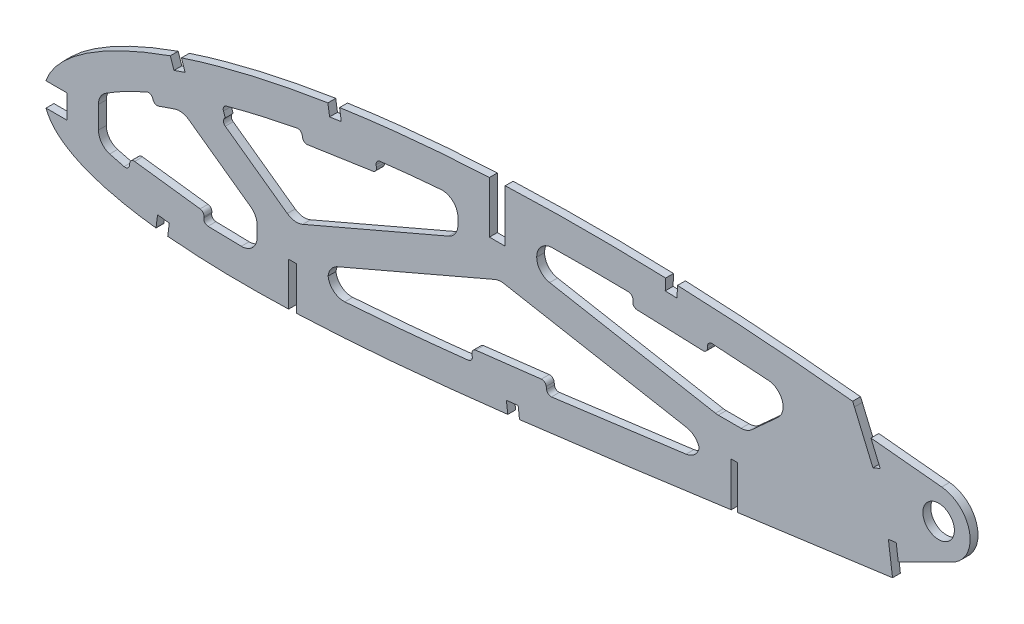
from build123d import *

# Parameters (mm, degrees)
BOSS_EXTRUDE1_DEPTH = 3.175
CUT_EXTRUDE1_DEPTH  = 7.62
SKETCH4_R           = 6.35
CUT_EXTRUDE2_DEPTH  = 7.62
CUT_EXTRUDE3_DEPTH  = 7.62
SKETCH6_W           = 9.525
SKETCH6_H           = 9.525
CUT_EXTRUDE4_DEPTH  = 7.62
CUT_EXTRUDE5_DEPTH  = 7.62
FILLET1_DEPTH       = 3.175
FILLET2_START       = -1
FILLET2_DEPTH       = 5
FILLET2_2_DEPTH     = 3.175


with BuildPart() as part:
    # Sketch1 → Boss-Extrude1 (new body)
    with BuildSketch(Plane.XY):
        with BuildLine():
            Line((502.79773875, -0.784854231), (507.466663145, -1.71152324))
            Line((507.466663145, -1.71152324), (503.425622155, 0.784854231))
            add(Edge.make_bspline(
                [(503.425622155, 0.784854231), (503.387056523, 0.808678383), (503.232943706, 0.903882506), (502.885699565, 1.116877467), (502.307465731, 1.471631004), (501.497989026, 1.96567955), (500.45789772, 2.597710645), (499.186668738, 3.363298805), (497.685095824, 4.259956995), (495.953542232, 5.283444029), (493.992185329, 6.428967913), (491.80177187, 7.691887565), (489.382492784, 9.065053582), (486.735285081, 10.542854645), (483.861056965, 12.118262786), (480.760352067, 13.784162223), (477.434280878, 15.532079613), (473.88412009, 17.354496627), (470.110517029, 19.241349676), (466.11525081, 21.184786117), (461.8996524, 23.175115764), (457.465160771, 25.201720056), (452.814323541, 27.256337372), (447.948426531, 29.326194505), (442.870242622, 31.402323167), (437.581933839, 33.472908178), (432.086631293, 35.528519181), (426.386455038, 37.555839622), (420.485666169, 39.546009798), (414.38712726, 41.486101224), (408.095199476, 43.365577113), (401.613538504, 45.172251969), (394.947547526, 46.896860198), (388.101454206, 48.526842247), (381.081061063, 50.051288093), (373.891948514, 51.461019148), (366.540145776, 52.741961538), (359.04602551, 53.893116322), (351.530166329, 54.850682287), (344.029770472, 55.789835004), (336.540544467, 56.672083061), (328.959784459, 57.516957665), (321.294783559, 58.319701885), (313.553144836, 59.077805613), (305.74270558, 59.787996951), (297.871582303, 60.448193241), (289.947391455, 61.054653465), (281.978488624, 61.606443402), (273.972752071, 62.098711989), (265.938708914, 62.531089773), (257.884514812, 62.900561137), (249.818551509, 63.204580293), (241.749383842, 63.441312028), (233.685387885, 63.608488355), (225.6352949, 63.705058175), (217.607478242, 63.728382774), (209.610665097, 63.678044957), (201.65322943, 63.552316286), (193.743907339, 63.349475598), (185.891084219, 63.06914433), (178.103251674, 62.711444076), (170.388936599, 62.273379295), (162.75650763, 61.757741728), (155.21446412, 61.162365234), (147.771092618, 60.487091521), (140.434193858, 59.734735375), (133.21193631, 58.903250486), (126.112060053, 57.995002679), (119.142330926, 57.011772691), (112.310569153, 55.953024983), (105.624093076, 54.821817655), (99.090119317, 53.619308085), (92.715560781, 52.349021738), (86.507357689, 51.011289913), (80.472081741, 49.610125488), (74.616005172, 48.147969617), (68.945423127, 46.627499094), (63.466083945, 45.052362302), (58.183528407, 43.426132862), (53.103914735, 41.750597597), (48.231081995, 40.032109382), (43.57101596, 38.271888166), (39.127286386, 36.475356686), (34.905100975, 34.644967962), (30.907613889, 32.786301909), (27.139349344, 30.901474598), (23.602993011, 28.995766687), (20.302095112, 27.072100319), (17.239833127, 25.134048547), (14.417494091, 23.186527339), (11.838969232, 21.230759107), (9.505144331, 19.27168598), (7.417496279, 17.312291137), (5.579009223, 15.353924281), (3.9896169, 13.40003417), (2.651402342, 11.45216816), (1.564597701, 9.512169406), (0.731661122, 7.581447178), (0.1517667, 5.66108724), (-0.165663648, 3.753924021), (-0.244673978, 1.85842856), (-0.081436131, 0.618550581), (0, 0)],
                knots=[0, 0, 0, 0, 0.00025409, 0.001015373, 0.002283359, 0.004056577, 0.006330982, 0.009105275, 0.012374489, 0.016134023, 0.02037966, 0.025105976, 0.030306237, 0.035972206, 0.042099522, 0.048678064, 0.055701664, 0.063160184, 0.071045824, 0.079349826, 0.08806291, 0.097175757, 0.106678112, 0.116561573, 0.126814276, 0.1374283, 0.148393618, 0.15969976, 0.171338126, 0.183297699, 0.195569604, 0.208143556, 0.221011593, 0.234161831, 0.24758745, 0.261276822, 0.27522271, 0.289414144, 0.3037712, 0.317689227, 0.331784111, 0.346039677, 0.36044387, 0.374982721, 0.389640455, 0.404403317, 0.419256601, 0.434186749, 0.449177265, 0.464214782, 0.479284009, 0.49436974, 0.509457833, 0.524532346, 0.53957932, 0.554582984, 0.569529546, 0.584403417, 0.599190992, 0.613876838, 0.628447475, 0.642888675, 0.657186054, 0.671325546, 0.685294014, 0.699078147, 0.712665095, 0.726042645, 0.739197713, 0.752117586, 0.764792042, 0.777208152, 0.789355685, 0.80122396, 0.812803686, 0.824082909, 0.835054602, 0.845709571, 0.856037853, 0.866033834, 0.875688843, 0.884997719, 0.893953426, 0.902552897, 0.910789386, 0.918660734, 0.926166253, 0.933302626, 0.94007122, 0.94647478, 0.952517526, 0.958204819, 0.963546652, 0.9685566, 0.973249913, 0.977651041, 0.981787043, 0.985694226, 0.989415109, 0.993001157, 0.996508416, 1, 1, 1, 1], degree=3))
            add(Edge.make_bspline(
                [(0, 0), (0.129277918, -0.610277991), (0.388427893, -1.8336387), (1.09250455, -3.594771251), (2.023612315, -5.287729771), (3.201293003, -6.908017366), (4.61771618, -8.455191194), (6.269753486, -9.930860517), (8.155784822, -11.334231849), (10.273341647, -12.664666589), (12.619347944, -13.923576968), (15.191166787, -15.110180321), (17.986453192, -16.224105848), (21.002161638, -17.263864435), (24.234605302, -18.231039739), (27.680710983, -19.123274687), (31.336560086, -19.941816444), (35.198636392, -20.684575522), (39.262731423, -21.352306607), (43.524623173, -21.944635889), (47.97993709, -22.461933953), (52.624302184, -22.903115294), (57.453124717, -23.269128853), (62.461591735, -23.56021739), (67.644841608, -23.77730407), (72.997909324, -23.919563453), (78.51555217, -23.989213541), (84.19278374, -23.987299874), (90.024050352, -23.913310584), (96.004370725, -23.771333186), (102.128006069, -23.560468263), (108.38942798, -23.283267615), (114.782988575, -22.942520838), (121.302953529, -22.539383102), (127.943585047, -22.075641101), (134.699117226, -21.555013733), (141.563413308, -20.978799747), (148.530486699, -20.350357624), (155.594169408, -19.672833542), (162.748358534, -18.948371701), (169.986739237, -18.180380072), (177.302864412, -17.371347266), (184.690510287, -16.525589468), (192.142928282, -15.644636961), (199.653816553, -14.733519469), (207.21610926, -13.793977853), (214.823482798, -12.829630943), (222.469095066, -11.845019347), (230.145788458, -10.840030717), (237.847106351, -9.821825282), (245.565621831, -8.789564391), (253.29461644, -7.748557009), (261.026935583, -6.702038843), (268.755047845, -5.650332066), (276.472159998, -4.597795103), (284.171113039, -3.547317471), (291.844365725, -2.498995132), (299.484975802, -1.458038633), (307.085249349, -0.424320765), (314.63817827, 0.600062666), (322.136524598, 1.612053914), (329.5732141, 2.610375922), (336.940575301, 3.59439687), (344.231196069, 4.564486382), (351.328594574, 5.491199859), (358.214225209, 6.423884937), (364.911291302, 7.188480074), (371.524970385, 7.841089466), (378.062132498, 8.376139176), (384.514927939, 8.801326851), (390.8759632, 9.119690648), (397.137657243, 9.335675398), (403.292100638, 9.455688483), (409.331606334, 9.482775598), (415.247930621, 9.425574995), (421.03337879, 9.288697453), (426.679876255, 9.07828687), (432.179545635, 8.801442011), (437.52457516, 8.465709972), (442.70694032, 8.076042936), (447.719419769, 7.641538035), (452.554279933, 7.168555777), (457.204096822, 6.662500198), (461.662085653, 6.133975032), (465.921110964, 5.586460219), (469.974766574, 5.028953281), (473.816527145, 4.467104121), (477.440308359, 3.908085671), (480.840416637, 3.3572311), (484.011359843, 2.821851589), (486.948170814, 2.306949228), (489.645753402, 1.817552616), (492.100365244, 1.35983632), (494.307158383, 0.936074272), (496.26318146, 0.553249972), (497.964797452, 0.213052808), (499.40951194, -0.07972438), (500.594801875, -0.323926), (501.518867114, -0.515543372), (502.179882379, -0.654882666), (502.577132717, -0.73779659), (502.753636076, -0.775446656), (502.79773875, -0.784854231)],
                knots=[0, 0, 0, 0, 0.003638255, 0.007293231, 0.011028136, 0.014901081, 0.018963272, 0.023258475, 0.027820626, 0.032679082, 0.03785316, 0.043361875, 0.049214679, 0.055422346, 0.061988786, 0.068918036, 0.076211157, 0.083868392, 0.091887411, 0.100265912, 0.108999867, 0.118084529, 0.127514843, 0.13728527, 0.147387917, 0.157816481, 0.168563473, 0.179619128, 0.190977373, 0.202626974, 0.214560478, 0.226767249, 0.239236417, 0.251959004, 0.264923894, 0.278119703, 0.291536035, 0.30516028, 0.318980685, 0.332985499, 0.34716279, 0.361498603, 0.375980747, 0.390597192, 0.405332593, 0.420174823, 0.435109533, 0.450124276, 0.465203068, 0.480333154, 0.495500583, 0.510689775, 0.525887334, 0.541078314, 0.556247233, 0.571381784, 0.586466041, 0.601484516, 0.616424329, 0.631269422, 0.646006524, 0.660620684, 0.675098188, 0.689422858, 0.703581825, 0.716907564, 0.730009274, 0.742952128, 0.755725558, 0.768319952, 0.780724337, 0.792926529, 0.804916041, 0.816679084, 0.828203524, 0.8394749, 0.850481359, 0.861207697, 0.871639326, 0.881763414, 0.891563605, 0.901027364, 0.910138977, 0.918883976, 0.927249278, 0.935221104, 0.942784739, 0.949928188, 0.956638464, 0.962904203, 0.968712287, 0.974054485, 0.978918432, 0.983297219, 0.987180246, 0.990560674, 0.993433357, 0.995790625, 0.997629587, 0.998945816, 0.999736592, 1, 1, 1, 1], degree=3))
        make_face()
    extrude(amount=BOSS_EXTRUDE1_DEPTH)

    # Sketch2 → Cut-Extrude1 (cut)
    with BuildSketch(Plane(origin=(0, 0, 0), x_dir=(-1, 0, 0), z_dir=(0, 0, -1))):
        Polygon((-279.413002946, 13.21847221), (-279.413002946, -4.264699258), (-279.413002946, -6.818557317), (-276.873002946, -5.122534818), (-276.873002946, -4.264699258), (-276.873002946, 13.21847221), align=None)
        Polygon((-185.750502946, 63.107536983), (-185.750502946, 41.934206686), (-179.400502946, 41.934206686), (-179.400502946, 63.107536983), (-179.400502946, 64.432487728), (-185.750502946, 65.757438473), align=None)
        Polygon((-101.613002946, -6.256573794), (-101.613002946, -23.265591987), (-101.613002946, -26.514719631), (-98.438002946, -24.394691507), (-98.438002946, -23.265591987), (-98.438002946, -6.256573794), align=None)
    extrude(amount=-CUT_EXTRUDE1_DEPTH, mode=Mode.SUBTRACT)

    # Sketch4 → Cut-Extrude2 (cut)
    with BuildSketch(Plane.XY.offset(3.175)):
        with Locations((360.487560364, 33.232574886)):
            Circle(SKETCH4_R)
    extrude(amount=-CUT_EXTRUDE2_DEPTH, mode=Mode.SUBTRACT)

    # Sketch5 → Cut-Extrude3 (cut)
    with BuildSketch(Plane.XY.offset(3.175)):
        with BuildLine():
            Line((333.196757251, 48.690688822), (336.929505377, 39.927572001))
            Line((336.929505377, 39.927572001), (334.008466437, 38.683322625))
            Line((334.008466437, 38.683322625), (326.542970184, 56.209556268))
            Line((326.542970184, 56.209556268), (324.198393567, 61.45850412))
            Line((324.198393567, 61.45850412), (523.305580011, 35.530382301))
            Line((523.305580011, 35.530382301), (514.406192414, -32.809778928))
            Line((514.406192414, -32.809778928), (341.902934014, 3.553803464))
            Line((341.902934014, 3.553803464), (341.902934014, 4.252946837))
            Line((341.902934014, 4.252946837), (340.237223915, 16.843237138))
            Line((340.237223915, 16.843237138), (343.38479649, 17.259664663))
            Line((343.38479649, 17.259664663), (344.21765154, 10.964519512))
            Line((344.21765154, 10.964519512), (366.139810613, 21.859709498))
            ThreePointArc((366.139810613, 21.859709498), (372.979223815, 35.523501387), (361.736217891, 45.871042134))
            Line((361.736217891, 45.871042134), (333.196757251, 48.690688822))
        make_face()
    extrude(amount=-CUT_EXTRUDE3_DEPTH, mode=Mode.SUBTRACT)

    # Sketch6 → Cut-Extrude4 (cut)
    with BuildSketch(Plane.XY.offset(3.175)):
        with BuildLine():
            Line((255.026015442, 58.426911385), (255.214942852, 63.177405441))
            ThreePointArc((255.214942852, 63.177405441), (252.823432723, 63.26746979), (250.431849142, 63.355562153))
            Line((250.431849142, 63.355562153), (250.266853109, 58.599915418))
            Line((250.266853109, 58.599915418), (255.026015442, 58.426911385))
        make_face()
        Polygon((44.994366086, -21.890542132), (44.85009688, -23.019303443), (49.56419933, -23.621822161), (49.708468536, -22.49306085), (50.316307001, -17.739530098), (45.597779403, -17.139339012), align=None)
        with BuildLine():
            Line((191.525874725, -15.793654723), (190.968107766, -11.062115846))
            Line((190.968107766, -11.062115846), (186.238358051, -11.619670091))
            Line((186.238358051, -11.619670091), (186.792642549, -16.353309987))
            ThreePointArc((186.792642549, -16.353309987), (189.159313238, -16.073944137), (191.525874725, -15.793654723))
        make_face()
        with BuildLine():
            Line((119.666492796, 52.394673315), (118.962403958, 57.12030453))
            ThreePointArc((118.962403958, 57.12030453), (116.600653106, 56.75858533), (114.239525451, 56.392820288))
            Line((114.239525451, 56.392820288), (114.956010687, 51.692818164))
            Line((114.956010687, 51.692818164), (119.666492796, 52.394673315))
        make_face()
        with BuildLine():
            Line((56.719602573, 38.113855262), (55.173388508, 42.585738556))
            add(Edge.make_bspline(
                [(55.173388508, 42.585738556), (54.421521597, 42.331174982), (52.918573752, 41.819684754), (51.417363489, 41.303205373), (50.667247247, 41.043622456)],
                knots=[0, 0, 0, 0, 0.5, 1, 1, 1, 1], degree=3))
            Line((50.667247247, 41.043622456), (52.218688236, 36.557487136))
            Line((52.218688236, 36.557487136), (56.719602573, 38.113855262))
        make_face()
        with Locations((4.293519509, 2.37027945)):
            Rectangle(SKETCH6_W, SKETCH6_H)
    extrude(amount=-CUT_EXTRUDE4_DEPTH, mode=Mode.SUBTRACT)

    # Sketch7 → Cut-Extrude5 (cut)
    with BuildSketch(Plane.XY.offset(3.175)):
        with BuildLine():
            Line((64.525645131, -6.744613156), (63.993493934, -10.906240346))
            add(Edge.make_bspline(
                [(63.993493934, -10.906240346), (65.798857716, -10.99109241), (69.407867305, -11.128515245), (74.843584256, -11.249816803), (80.285422442, -11.295829194), (83.921210287, -11.28027931), (85.738002946, -11.262067595)],
                knots=[0.194871208, 0.194871208, 0.194871208, 0.194871208, 0.351594431, 0.508317653, 0.665040875, 0.821764097, 0.821764097, 0.821764097, 0.821764097], degree=3))
            Line((85.738002946, -11.262067595), (85.738002946, 2.539808503))
            Line((85.738002946, 2.539808503), (55.510654405, 24.25797602))
            Line((55.510654405, 24.25797602), (44.366848149, 20.404566788))
            Line((44.366848149, 20.404566788), (43.016112705, 24.310343434))
            add(Edge.make_bspline(
                [(43.016112705, 24.310343434), (41.12291207, 23.503373305), (37.355785813, 21.81828662), (31.870087212, 19.076012384), (27.48540759, 16.593619198), (24.138971274, 14.465067499), (22.544235292, 13.362778263), (21.756019509, 12.789681138)],
                knots=[0.172230858, 0.172230858, 0.172230858, 0.172230858, 0.33490821, 0.497585563, 0.660262915, 0.741601591, 0.822940267, 0.822940267, 0.822940267, 0.822940267], degree=3))
            Line((21.756019509, 12.789681138), (21.756019509, -4.045628102))
            add(Edge.make_bspline(
                [(21.756019509, -4.045628102), (22.722363912, -4.419449474), (24.663937743, -5.103139935), (27.707492352, -6.01448762), (30.825723836, -6.815353217), (32.95537213, -7.28794581), (34.018952516, -7.508120133)],
                knots=[0.17588566, 0.17588566, 0.17588566, 0.17588566, 0.313722405, 0.451559149, 0.589395894, 0.727232638, 0.727232638, 0.727232638, 0.727232638], degree=3))
            Line((34.018952516, -7.508120133), (34.599364598, -2.938025943))
            Line((34.599364598, -2.938025943), (64.525645131, -6.744613156))
        make_face()
        with BuildLine():
            Line((104.308541823, 37.266160601), (103.656784645, 41.541559402))
            add(Edge.make_bspline(
                [(103.656784645, 41.541559402), (100.949330073, 41.037096024), (95.541208801, 39.976519029), (87.478554376, 38.223858132), (79.463490607, 36.296213155), (74.168823222, 34.886226076), (71.52948578, 34.145384293)],
                knots=[0.14006006, 0.14006006, 0.14006006, 0.14006006, 0.319104981, 0.498149902, 0.677194823, 0.856239744, 0.856239744, 0.856239744, 0.856239744], degree=3))
            Line((71.52948578, 34.145384293), (72.872397657, 30.261481482))
            Line((72.872397657, 30.261481482), (70.204299061, 29.338881472))
            Line((70.204299061, 29.338881472), (100.815368769, 7.345012612))
            Line((100.815368769, 7.345012612), (166.700502946, 35.671055422))
            Line((166.700502946, 35.671055422), (166.700502946, 49.291249383))
            add(Edge.make_bspline(
                [(166.700502946, 49.291249383), (163.920314563, 49.100239305), (158.361083083, 48.683856756), (150.037920978, 47.951542721), (141.729046314, 47.105862401), (136.202571792, 46.463144683), (133.441422369, 46.120987622)],
                knots=[0.144445541, 0.144445541, 0.144445541, 0.144445541, 0.323770468, 0.503095394, 0.68242032, 0.861745246, 0.861745246, 0.861745246, 0.861745246], degree=3))
            Line((133.441422369, 46.120987622), (134.0993832, 41.704953702))
            Line((134.0993832, 41.704953702), (104.308541823, 37.266160601))
        make_face()
        with BuildLine():
            Line((202.093959365, 3.037363046), (202.636442389, -1.564522164))
            add(Edge.make_bspline(
                [(202.636442389, -1.564522164), (207.765497606, -0.926314136), (218.017744366, 0.377416253), (233.402937454, 2.394786587), (248.785516683, 4.453357201), (259.04457206, 5.845389759), (264.173002946, 6.543341752)],
                knots=[0.086275765, 0.086275765, 0.086275765, 0.086275765, 0.295995146, 0.505714527, 0.715433907, 0.925153288, 0.925153288, 0.925153288, 0.925153288], degree=3))
            Line((264.173002946, 6.543341752), (264.173002946, 14.270410868))
            Line((264.173002946, 14.270410868), (183.323116669, 28.993629959))
            Line((183.323116669, 28.993629959), (114.313002946, -0.67593754))
            Line((114.313002946, -0.67593754), (114.313002946, -10.239260711))
            add(Edge.make_bspline(
                [(114.313002946, -10.239260711), (119.179360985, -9.957320676), (128.901134747, -9.299237237), (143.499725878, -8.081704889), (158.093746181, -6.67885562), (167.826214875, -5.641522526), (172.688512569, -5.102932988)],
                knots=[0.09335321, 0.09335321, 0.09335321, 0.09335321, 0.297846463, 0.502339715, 0.706832968, 0.911326221, 0.911326221, 0.911326221, 0.911326221], degree=3))
            Line((172.688512569, -5.102932988), (172.148673585, -0.492659098))
            Line((172.148673585, -0.492659098), (202.093959365, 3.037363046))
        make_face()
        with BuildLine():
            Line((237.134859513, 46.368898341), (237.289573443, 50.828186112))
            add(Edge.make_bspline(
                [(237.289573443, 50.828186112), (234.052057943, 50.894729701), (227.575607933, 50.993491278), (217.863858047, 51.034824957), (208.153890213, 50.96606937), (201.684890057, 50.843719607), (198.450502946, 50.762542161)],
                knots=[0.124405528, 0.124405528, 0.124405528, 0.124405528, 0.313394542, 0.502383556, 0.69137257, 0.880361584, 0.880361584, 0.880361584, 0.880361584], degree=3))
            Line((198.450502946, 50.762542161), (198.450502946, 39.147711947))
            Line((198.450502946, 39.147711947), (271.096472667, 25.91847221))
            Line((271.096472667, 25.91847221), (283.31484347, 25.91847221))
            Line((283.31484347, 25.91847221), (306.546134519, 46.958941729))
            add(Edge.make_bspline(
                [(306.546134519, 46.958941729), (303.287063926, 47.249583186), (296.765951384, 47.801980831), (286.979311637, 48.541610139), (277.187242033, 49.190346675), (270.656502837, 49.560867305), (267.39019107, 49.730319341)],
                knots=[0.239076645, 0.239076645, 0.239076645, 0.239076645, 0.402682648, 0.566288651, 0.729894654, 0.893500656, 0.893500656, 0.893500656, 0.893500656], degree=3))
            Line((267.39019107, 49.730319341), (267.213022807, 45.275503495))
            Line((267.213022807, 45.275503495), (237.134859513, 46.368898341))
        make_face()
    extrude(amount=-CUT_EXTRUDE5_DEPTH, mode=Mode.SUBTRACT)

    # Fillet1: read off the stored shape, not the designer's step
    # Fillet1 outline → Fillet1 (add)
    with BuildSketch(Plane.XY):
        with BuildLine():
            Line((264.173002946, 14.270410868), (258.960663704, 15.219607165))
            ThreePointArc((258.960663704, 15.219607165), (262.158426219, 13.612026783), (263.978874054, 10.530473689))
            ThreePointArc((263.978874054, 10.530473689), (262.052426317, 7.352093027), (258.677102321, 5.796299841))
            add(Edge.make_bspline(
                [(258.677102321, 5.796299841), (260.50914541, 6.044976375), (262.341144148, 6.294035575), (264.173002946, 6.543341752)],
                knots=[0.850242209, 0.850242209, 0.850242209, 0.850242209, 0.925153288, 0.925153288, 0.925153288, 0.925153288], degree=3))
            Line((264.173002946, 6.543341752), (264.173002946, 14.270410868))
        make_face()
        with BuildLine():
            Line((183.323116669, 28.993629959), (181.562645298, 28.236749245))
            ThreePointArc((181.562645298, 28.236749245), (183.354997188, 28.712587763), (185.20839115, 28.650310871))
            Line((185.20839115, 28.650310871), (183.323116669, 28.993629959))
        make_face()
        with BuildLine():
            ThreePointArc((114.350419125, -4.169555547), (115.557146349, -1.082597744), (118.154917852, 0.975819681))
            Line((118.154917852, 0.975819681), (114.313002946, -0.67593754))
            Line((114.313002946, -0.67593754), (114.313002946, -10.239260711))
            add(Edge.make_bspline(
                [(114.313002946, -10.239260711), (116.571193507, -10.108428922), (118.82820594, -9.967454529), (121.084852251, -9.817206918)],
                knots=[0.09335321, 0.09335321, 0.09335321, 0.09335321, 0.188246502, 0.188246502, 0.188246502, 0.188246502], degree=3))
            ThreePointArc((121.084852251, -9.817206918), (116.5826623, -8.346758394), (114.350419125, -4.169555547))
        make_face()
        with BuildLine():
            Line((198.450502946, 50.762542161), (198.450502946, 44.545516718))
            ThreePointArc((198.450502946, 44.545516718), (200.271812388, 48.996748214), (204.690963365, 50.894571851))
            add(Edge.make_bspline(
                [(204.690963365, 50.894571851), (202.610592073, 50.858679424), (200.530524149, 50.814747047), (198.450502946, 50.762542161)],
                knots=[0.758823518, 0.758823518, 0.758823518, 0.758823518, 0.880361584, 0.880361584, 0.880361584, 0.880361584], degree=3))
        make_face()
        with BuildLine():
            Line((198.450502946, 39.147711947), (203.662842188, 38.198515651))
            ThreePointArc((203.662842188, 38.198515651), (199.924713481, 40.377705308), (198.450502946, 44.445773289))
            Line((198.450502946, 44.445773289), (198.450502946, 39.147711947))
        make_face()
        with BuildLine():
            Line((271.096472667, 25.91847221), (271.669942387, 25.91847221))
            ThreePointArc((271.669942387, 25.91847221), (271.098797048, 25.94420996), (270.532281629, 26.021214571))
            Line((270.532281629, 26.021214571), (271.096472667, 25.91847221))
        make_face()
        with BuildLine():
            Line((283.31484347, 25.91847221), (285.129398513, 27.561906059))
            ThreePointArc((285.129398513, 27.561906059), (283.150956848, 26.343558917), (280.866683994, 25.91847221))
            Line((280.866683994, 25.91847221), (283.31484347, 25.91847221))
        make_face()
        with BuildLine():
            ThreePointArc((291.906298532, 48.165487935), (297.434555836, 43.892764991), (295.690430343, 37.126982224))
            Line((295.690430343, 37.126982224), (306.546134519, 46.958941729))
            add(Edge.make_bspline(
                [(306.546134519, 46.958941729), (303.287063926, 47.249583186), (298.407518295, 47.662925158), (293.526117159, 48.043058279), (291.906298532, 48.165487935)],
                knots=[0.239076645, 0.239076645, 0.239076645, 0.239076645, 0.402682648, 0.483919209, 0.483919209, 0.483919209, 0.483919209], degree=3))
        make_face()
        with BuildLine():
            Line((166.700502946, 35.671055422), (166.700502946, 39.852994214))
            ThreePointArc((166.700502946, 39.852994214), (165.653749138, 36.360419258), (162.858588041, 34.019298202))
            Line((162.858588041, 34.019298202), (166.700502946, 35.671055422))
        make_face()
        with BuildLine():
            Line((100.815368769, 7.345012612), (104.113319687, 8.762903006))
            ThreePointArc((104.113319687, 8.762903006), (100.917639301, 8.283936132), (97.900016338, 9.439675741))
            Line((97.900016338, 9.439675741), (100.815368769, 7.345012612))
        make_face()
        with BuildLine():
            ThreePointArc((159.849695077, 48.785185475), (164.659932725, 47.118795489), (166.700502946, 42.454964983))
            Line((166.700502946, 42.454964983), (166.700502946, 49.291249383))
            add(Edge.make_bspline(
                [(166.700502946, 49.291249383), (164.416136222, 49.134304239), (162.132156104, 48.965759666), (159.849695077, 48.785185475)],
                knots=[0.144445541, 0.144445541, 0.144445541, 0.144445541, 0.291789476, 0.291789476, 0.291789476, 0.291789476], degree=3))
        make_face()
        with BuildLine():
            ThreePointArc((52.401726228, 23.182941847), (55.39480264, 23.464915602), (58.182142911, 22.33852765))
            Line((58.182142911, 22.33852765), (55.510654405, 24.25797602))
            Line((55.510654405, 24.25797602), (52.401726228, 23.182941847))
        make_face()
        with BuildLine():
            ThreePointArc((83.093221201, 4.440068227), (85.038252317, 2.180934114), (85.738002946, -0.71685505))
            Line((85.738002946, -0.71685505), (85.738002946, 2.539808503))
            Line((85.738002946, 2.539808503), (83.093221201, 4.440068227))
        make_face()
        with BuildLine():
            ThreePointArc((85.738002946, -4.931393274), (83.868546748, -9.431085179), (79.360923501, -11.281335534))
            add(Edge.make_bspline(
                [(79.360923501, -11.281335534), (79.66969381, -11.28265229), (81.794100771, -11.289376735), (83.921210287, -11.28027931), (85.738002946, -11.262067595)],
                knots=[0.638382959, 0.638382959, 0.638382959, 0.638382959, 0.665040875, 0.821764097, 0.821764097, 0.821764097, 0.821764097], degree=3))
            Line((85.738002946, -11.262067595), (85.738002946, -4.931393274))
        make_face()
        with BuildLine():
            ThreePointArc((26.288260491, -5.583563251), (23.013609973, -3.292698157), (21.756019509, 0.500699412))
            Line((21.756019509, 0.500699412), (21.756019509, -4.045628102))
            add(Edge.make_bspline(
                [(21.756019509, -4.045628102), (22.722363912, -4.419449474), (24.209940452, -4.943272918), (25.748859027, -5.422409479), (26.288260491, -5.583563251)],
                knots=[0.17588566, 0.17588566, 0.17588566, 0.17588566, 0.313722405, 0.387098548, 0.387098548, 0.387098548, 0.387098548], degree=3))
        make_face()
        with BuildLine():
            ThreePointArc((21.756019509, 9.45151425), (22.522288264, 12.475492654), (24.636159788, 14.769650532))
            add(Edge.make_bspline(
                [(24.636159788, 14.769650532), (24.476262358, 14.6653242), (23.496263796, 14.020824977), (22.544235292, 13.362778263), (21.756019509, 12.789681138)],
                knots=[0.725824833, 0.725824833, 0.725824833, 0.725824833, 0.741601591, 0.822940267, 0.822940267, 0.822940267, 0.822940267], degree=3))
            Line((21.756019509, 12.789681138), (21.756019509, 9.45151425))
        make_face()
    extrude(amount=FILLET1_DEPTH)

    # Fillet2: read off the stored shape, not the designer's step
    # Fillet2 outline → Fillet2 (cut)
    with BuildSketch(Plane.XY.offset(FILLET2_START)):
        with BuildLine():
            Line((237.134859513, 46.368898341), (238.908747811, 46.30441434))
            ThreePointArc((238.908747811, 46.30441434), (237.672262315, 46.869430328), (237.196407765, 48.142890926))
            Line((237.196407765, 48.142890926), (237.134859513, 46.368898341))
        make_face()
        with BuildLine():
            Line((267.213022807, 45.275503495), (267.283437349, 47.0460453))
            ThreePointArc((267.283437349, 47.0460453), (266.715351201, 45.812557597), (265.44225097, 45.339874208))
            Line((265.44225097, 45.339874208), (267.213022807, 45.275503495))
        make_face()
        with BuildLine():
            ThreePointArc((172.355294723, -2.257222362), (172.725880102, -0.948494946), (173.913075792, -0.284667132))
            Line((173.913075792, -0.284667132), (172.148673585, -0.492659098))
            Line((172.148673585, -0.492659098), (172.355294723, -2.257222362))
        make_face()
        with BuildLine():
            ThreePointArc((200.328186523, 2.829209506), (201.637743463, 2.459213462), (202.302113568, 1.271590283))
            Line((202.302113568, 1.271590283), (202.093959365, 3.037363046))
            Line((202.093959365, 3.037363046), (200.328186523, 2.829209506))
        make_face()
        with BuildLine():
            Line((104.308541823, 37.266160601), (106.061214334, 37.527306319))
            ThreePointArc((106.061214334, 37.527306319), (104.743368046, 37.855323068), (104.041493734, 39.017943503))
            Line((104.041493734, 39.017943503), (104.308541823, 37.266160601))
        make_face()
        with BuildLine():
            Line((134.0993832, 41.704953702), (133.837366159, 43.463532763))
            ThreePointArc((133.837366159, 43.463532763), (133.507565273, 42.143283622), (132.340805413, 41.442928106))
            Line((132.340805413, 41.442928106), (134.0993832, 41.704953702))
        make_face()
        with BuildLine():
            ThreePointArc((34.375310687, -4.702199205), (35.050460482, -3.520487505), (36.36349448, -3.162421161))
            Line((36.36349448, -3.162421161), (34.599364598, -2.938025943))
            Line((34.599364598, -2.938025943), (34.375310687, -4.702199205))
        make_face()
        with BuildLine():
            ThreePointArc((62.760689602, -6.520112916), (63.94252526, -7.195820277), (64.299977637, -8.50941982))
            Line((64.299977637, -8.50941982), (64.525645131, -6.744613156))
            Line((64.525645131, -6.744613156), (62.760689602, -6.520112916))
        make_face()
        with BuildLine():
            ThreePointArc((46.047161321, 20.985601144), (44.688799066, 21.066888928), (43.785752474, 22.084858756))
            Line((43.785752474, 22.084858756), (44.366848149, 20.404566788))
            Line((44.366848149, 20.404566788), (46.047161321, 20.985601144))
        make_face()
    extrude(amount=FILLET2_DEPTH, mode=Mode.SUBTRACT)

    # Fillet2 2 outline → Fillet2 2 (add)
    with BuildSketch(Plane.XY):
        with BuildLine():
            ThreePointArc((235.483071879, 50.863530212), (236.740315043, 50.309155479), (237.22698411, 49.024186633))
            Line((237.22698411, 49.024186633), (237.289573443, 50.828186112))
            add(Edge.make_bspline(
                [(237.289573443, 50.828186112), (236.687428231, 50.840562548), (236.085258476, 50.852345284), (235.483071879, 50.863530212)],
                knots=[0.124405528, 0.124405528, 0.124405528, 0.124405528, 0.159555577, 0.159555577, 0.159555577, 0.159555577], degree=3))
        make_face()
        with BuildLine():
            ThreePointArc((267.31861329, 47.930528428), (267.898007102, 49.174404201), (269.190478284, 49.635318913))
            add(Edge.make_bspline(
                [(269.190478284, 49.635318913), (268.590413239, 49.667518066), (267.990318057, 49.699185528), (267.39019107, 49.730319341)],
                knots=[0.863440949, 0.863440949, 0.863440949, 0.863440949, 0.893500656, 0.893500656, 0.893500656, 0.893500656], degree=3))
            Line((267.39019107, 49.730319341), (267.31861329, 47.930528428))
        make_face()
        with BuildLine():
            Line((172.688512569, -5.102932988), (172.480329317, -3.325029132))
            ThreePointArc((172.480329317, -3.325029132), (172.105299049, -4.639361712), (170.90833271, -5.29920216))
            add(Edge.make_bspline(
                [(170.90833271, -5.29920216), (171.501778902, -5.23408256), (172.095175045, -5.16865611), (172.688512569, -5.102932988)],
                knots=[0.886372273, 0.886372273, 0.886372273, 0.886372273, 0.911326221, 0.911326221, 0.911326221, 0.911326221], degree=3))
        make_face()
        with BuildLine():
            ThreePointArc((204.413272641, -1.342876245), (203.096183561, -0.978276632), (202.426876212, 0.213228381))
            Line((202.426876212, 0.213228381), (202.636442389, -1.564522164))
            add(Edge.make_bspline(
                [(202.636442389, -1.564522164), (203.22875615, -1.490820599), (203.821030812, -1.4169369), (204.413272641, -1.342876245)],
                knots=[0.086275765, 0.086275765, 0.086275765, 0.086275765, 0.110494587, 0.110494587, 0.110494587, 0.110494587], degree=3))
        make_face()
        with BuildLine():
            ThreePointArc((72.905575745, 27.398030476), (72.165156195, 28.821369137), (72.872397657, 30.261481482))
            Line((72.872397657, 30.261481482), (70.204299061, 29.338881472))
            Line((70.204299061, 29.338881472), (72.905575745, 27.398030476))
        make_face()
        with BuildLine():
            ThreePointArc((72.147880755, 32.356893162), (72.255466727, 33.767113293), (73.358239683, 34.652656836))
            add(Edge.make_bspline(
                [(73.358239683, 34.652656836), (72.748194859, 34.485437556), (72.138627357, 34.316365663), (71.52948578, 34.145384293)],
                knots=[0.814917364, 0.814917364, 0.814917364, 0.814917364, 0.856239744, 0.856239744, 0.856239744, 0.856239744], degree=3))
            Line((71.52948578, 34.145384293), (72.147880755, 32.356893162))
        make_face()
        with BuildLine():
            ThreePointArc((101.843489292, 41.199718104), (103.203196588, 40.904884721), (103.934294331, 39.721150483))
            Line((103.934294331, 39.721150483), (103.656784645, 41.541559402))
            add(Edge.make_bspline(
                [(103.656784645, 41.541559402), (103.05216556, 41.428904442), (102.447715732, 41.314961578), (101.843489292, 41.199718104)],
                knots=[0.14006006, 0.14006006, 0.14006006, 0.14006006, 0.180043733, 0.180043733, 0.180043733, 0.180043733], degree=3))
        make_face()
        with BuildLine():
            ThreePointArc((133.710411709, 44.315612603), (134.055110853, 45.655686292), (135.256124098, 46.342841426))
            add(Edge.make_bspline(
                [(135.256124098, 46.342841426), (134.651115604, 46.269880541), (134.046218902, 46.195933006), (133.441422369, 46.120987622)],
                knots=[0.82246628, 0.82246628, 0.82246628, 0.82246628, 0.861745246, 0.861745246, 0.861745246, 0.861745246], degree=3))
            Line((133.441422369, 46.120987622), (133.710411709, 44.315612603))
        make_face()
        with BuildLine():
            Line((34.018952516, -7.508120133), (34.263243138, -5.584605464))
            ThreePointArc((34.263243138, -5.584605464), (33.519807822, -6.816642507), (32.108022267, -7.094982033))
            add(Edge.make_bspline(
                [(32.108022267, -7.094982033), (32.743442841, -7.238373636), (33.381421123, -7.376143233), (34.018952516, -7.508120133)],
                knots=[0.644610532, 0.644610532, 0.644610532, 0.644610532, 0.727232638, 0.727232638, 0.727232638, 0.727232638], degree=3))
        make_face()
        with BuildLine():
            ThreePointArc((65.929886556, -10.99115766), (64.644045072, -10.362014143), (64.238638726, -8.989113716))
            Line((64.238638726, -8.989113716), (63.993493934, -10.906240346))
            add(Edge.make_bspline(
                [(63.993493934, -10.906240346), (64.638998486, -10.936579048), (65.284393224, -10.964854318), (65.929886556, -10.99115766)],
                knots=[0.194871208, 0.194871208, 0.194871208, 0.194871208, 0.250907313, 0.250907313, 0.250907313, 0.250907313], degree=3))
        make_face()
        with BuildLine():
            ThreePointArc((41.246778481, 23.544336564), (42.674148103, 23.546172961), (43.642911712, 22.49789605))
            Line((43.642911712, 22.49789605), (43.016112705, 24.310343434))
            add(Edge.make_bspline(
                [(43.016112705, 24.310343434), (42.425214758, 24.058475257), (41.835255662, 23.803141669), (41.246778481, 23.544336564)],
                knots=[0.172230858, 0.172230858, 0.172230858, 0.172230858, 0.22300504, 0.22300504, 0.22300504, 0.22300504], degree=3))
        make_face()
    extrude(amount=FILLET2_2_DEPTH)


solid = part.part
